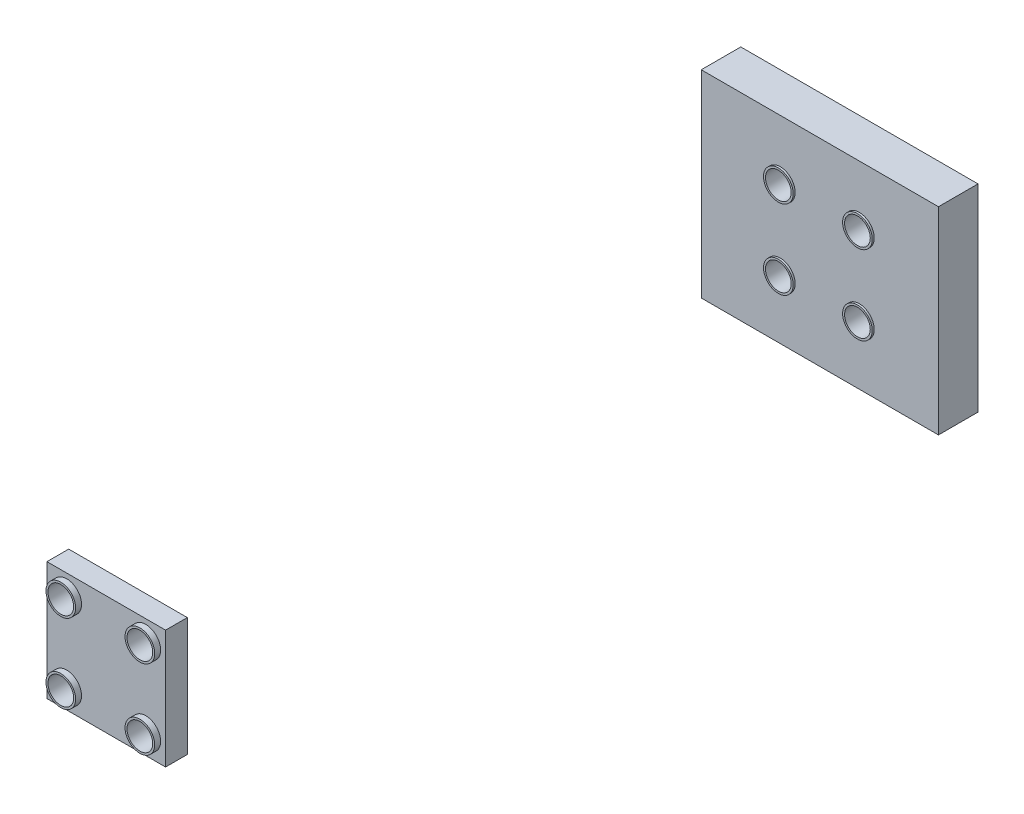
from build123d import *

# Parameters (mm, degrees)
THICKEN1_START       = -1500
THICKEN1_OUTLINE_W   = 3000
THICKEN1_OUTLINE_H   = 50
THICKEN1_DEPTH       = 3000
THICKEN2_START       = -1500
THICKEN2_OUTLINE_W   = 3000
THICKEN2_OUTLINE_H   = 500
THICKEN2_DEPTH       = 50
THICKEN3_START       = 1450
THICKEN3_OUTLINE_W   = 3000
THICKEN3_OUTLINE_H   = 500
THICKEN3_DEPTH       = 50
THICKEN4_START       = -1500
THICKEN4_OUTLINE_W   = 2900
THICKEN4_OUTLINE_H   = 50
THICKEN4_DEPTH       = 3000
THICKEN6_START       = -1500
THICKEN6_OUTLINE_W   = 2900
THICKEN6_OUTLINE_H   = 450
THICKEN6_DEPTH       = 50
THICKEN8_START       = 1450
THICKEN8_OUTLINE_W   = 2900
THICKEN8_OUTLINE_H   = 450
THICKEN8_DEPTH       = 50
SKETCH3_W            = 6000
SKETCH3_H            = 5000
BOSS_EXTRUDE1_DEPTH  = 1000
CUT_EXTRUDE3_START   = -20000
SKETCH2_R            = 325
CUT_EXTRUDE3_DEPTH   = 21000
LPATTERN2_COUNT      = 2
LPATTERN2_PITCH      = 2000
LPATTERN2_COUNT_DIR2 = 2
LPATTERN2_PITCH_DIR2 = 2000
SKETCH18_R           = 375
CUT_EXTRUDE5_DEPTH   = 1000
LPATTERN3_COUNT      = 2
LPATTERN3_PITCH      = 2000
LPATTERN3_COUNT_DIR2 = 2
LPATTERN3_PITCH_DIR2 = 2000
CUT_EXTRUDE6_START   = 1000
SKETCH19_R           = 375
CUT_EXTRUDE6_DEPTH   = 2200
LPATTERN4_COUNT      = 2
LPATTERN4_PITCH      = 2000
LPATTERN4_COUNT_DIR2 = 2
LPATTERN4_PITCH_DIR2 = 2000
BOSS_EXTRUDE2_START  = -1050
SKETCH20_R           = 375
SKETCH20_R_2         = 325
BOSS_EXTRUDE2_DEPTH  = 1100
LPATTERN5_COUNT      = 2
LPATTERN5_PITCH      = 2000
LPATTERN5_COUNT_DIR2 = 2
LPATTERN5_PITCH_DIR2 = 2000
SKETCH21_R           = 375
SKETCH21_R_2         = 325
BOSS_EXTRUDE3_DEPTH  = 800
LPATTERN6_COUNT      = 2
LPATTERN6_PITCH      = 2000
LPATTERN6_COUNT_DIR2 = 2
LPATTERN6_PITCH_DIR2 = 2000


# Read off the part's stored shape, not the designer's step: Thicken1, Thicken2, Thicken3, Thicken4, Thicken6, Thicken8
with BuildPart() as part:
    # Thicken1 outline → Thicken1 (new body)
    with BuildSketch(Plane.YZ.offset(THICKEN1_START)):
        with Locations((0, 25)):
            Rectangle(THICKEN1_OUTLINE_W, THICKEN1_OUTLINE_H)
    extrude(amount=THICKEN1_DEPTH)

    # Thicken2 outline → Thicken2 (add)
    with BuildSketch(Plane.YZ.offset(THICKEN2_START)):
        with Locations((0, -250)):
            Rectangle(THICKEN2_OUTLINE_W, THICKEN2_OUTLINE_H)
    extrude(amount=THICKEN2_DEPTH)

    # Thicken3 outline → Thicken3 (add)
    with BuildSketch(Plane.YZ.offset(THICKEN3_START)):
        with Locations((0, -250)):
            Rectangle(THICKEN3_OUTLINE_W, THICKEN3_OUTLINE_H)
    extrude(amount=THICKEN3_DEPTH)

    # Thicken4 outline → Thicken4 (add)
    with BuildSketch(Plane(origin=(0, 0, 0), x_dir=(1, 0, 0), z_dir=(0, 1, 0)).offset(THICKEN4_START)):
        with Locations((0, 475)):
            Rectangle(THICKEN4_OUTLINE_W, THICKEN4_OUTLINE_H)
    extrude(amount=THICKEN4_DEPTH)

    # Thicken6 outline → Thicken6 (add)
    with BuildSketch(Plane(origin=(0, 0, 0), x_dir=(1, 0, 0), z_dir=(0, 1, 0)).offset(THICKEN6_START)):
        with Locations((0, 225)):
            Rectangle(THICKEN6_OUTLINE_W, THICKEN6_OUTLINE_H)
    extrude(amount=THICKEN6_DEPTH)

    # Thicken8 outline → Thicken8 (add)
    with BuildSketch(Plane(origin=(0, 0, 0), x_dir=(1, 0, 0), z_dir=(0, 1, 0)).offset(THICKEN8_START)):
        with Locations((0, 225)):
            Rectangle(THICKEN8_OUTLINE_W, THICKEN8_OUTLINE_H)
    extrude(amount=THICKEN8_DEPTH)


with BuildPart() as body_2:
    # Sketch3 → Boss-Extrude1 (new body)
    with BuildSketch(Plane.XY.offset(-18000)):
        Rectangle(SKETCH3_W, SKETCH3_H)
    extrude(amount=-BOSS_EXTRUDE1_DEPTH)


with BuildPart() as cut_extrude3_tool:
    # Sketch2 → Cut-Extrude3 (new body)
    with BuildSketch(Plane.XY.offset(CUT_EXTRUDE3_START)):
        with Locations((1000, 1000)):
            Circle(SKETCH2_R)
    cut_extrude3 = extrude(amount=CUT_EXTRUDE3_DEPTH)


with BuildPart() as part_1:
    add(part.part)

    # Cut-Extrude3: cut by cut_extrude3_tool
    add(cut_extrude3_tool.part, mode=Mode.SUBTRACT)


with BuildPart() as body_2_1:
    add(body_2.part)

    # Cut-Extrude3: cut by cut_extrude3_tool
    add(cut_extrude3_tool.part, mode=Mode.SUBTRACT)


with BuildPart() as lpattern2_tool:
    # LPattern2: Cut-Extrude3 2 × 2
    with Locations(*[(-i * LPATTERN2_PITCH, -j * LPATTERN2_PITCH_DIR2, 0) for i in range(LPATTERN2_COUNT) for j in range(LPATTERN2_COUNT_DIR2) if (i, j) != (0, 0)]):
        add(cut_extrude3)


with BuildPart() as part_2:
    add(part_1.part)

    # LPattern2: cut by lpattern2_tool
    add(lpattern2_tool.part, mode=Mode.SUBTRACT)

    # Sketch18 → Cut-Extrude5 (cut)
    with BuildSketch(Plane.XY.offset(200)):
        with Locations((1000, 1000)):
            Circle(SKETCH18_R)
    cut_extrude5 = extrude(amount=-CUT_EXTRUDE5_DEPTH, mode=Mode.SUBTRACT)

    # LPattern3: Cut-Extrude5 2 × 2
    with Locations(*[(-i * LPATTERN3_PITCH, -j * LPATTERN3_PITCH_DIR2, 0) for i in range(LPATTERN3_COUNT) for j in range(LPATTERN3_COUNT_DIR2) if (i, j) != (0, 0)]):
        add(cut_extrude5, mode=Mode.SUBTRACT)


with BuildPart() as body_2_2:
    add(body_2_1.part)

    # LPattern2: cut by lpattern2_tool
    add(lpattern2_tool.part, mode=Mode.SUBTRACT)

    # Sketch19 → Cut-Extrude6 (cut)
    with BuildSketch(Plane.XY.offset(-18000).offset(CUT_EXTRUDE6_START)):
        with Locations((1000, 1000)):
            Circle(SKETCH19_R)
    cut_extrude6 = extrude(amount=-CUT_EXTRUDE6_DEPTH, mode=Mode.SUBTRACT)

    # LPattern4: Cut-Extrude6 2 × 2
    with Locations(*[(-i * LPATTERN4_PITCH, -j * LPATTERN4_PITCH_DIR2, 0) for i in range(LPATTERN4_COUNT) for j in range(LPATTERN4_COUNT_DIR2) if (i, j) != (0, 0)]):
        add(cut_extrude6, mode=Mode.SUBTRACT)


with BuildPart() as body_3:
    # Sketch20 → Boss-Extrude2 (new body)
    with BuildSketch(Plane.XY.offset(-18000).offset(BOSS_EXTRUDE2_START)):
        with Locations((1000, 1000)):
            Circle(SKETCH20_R)
        with Locations((1000, 1000)):
            Circle(SKETCH20_R_2, mode=Mode.SUBTRACT)
    boss_extrude2 = extrude(amount=BOSS_EXTRUDE2_DEPTH)


with BuildPart() as lpattern5_1:
    # LPattern5: Boss-Extrude2 2 × 2
    with Locations(*[(-i * LPATTERN5_PITCH, -j * LPATTERN5_PITCH_DIR2, 0) for i in range(LPATTERN5_COUNT) for j in range(LPATTERN5_COUNT_DIR2) if (i, j) != (0, 0)]):
        add(boss_extrude2)


with BuildPart() as body_7:
    # Sketch21 → Boss-Extrude3 (new body)
    with BuildSketch(Plane.XY.offset(200)):
        with Locations((1000, 1000)):
            Circle(SKETCH21_R)
        with Locations((1000, 1000)):
            Circle(SKETCH21_R_2, mode=Mode.SUBTRACT)
    boss_extrude3 = extrude(amount=-BOSS_EXTRUDE3_DEPTH)


with BuildPart() as lpattern6_1:
    # LPattern6: Boss-Extrude3 2 × 2
    with Locations(*[(-j * LPATTERN6_PITCH_DIR2, -i * LPATTERN6_PITCH, 0) for i in range(LPATTERN6_COUNT) for j in range(LPATTERN6_COUNT_DIR2) if (i, j) != (0, 0)]):
        add(boss_extrude3)


solid = Compound([part_2.part, body_2_2.part, body_3.part, lpattern5_1.part, body_7.part, lpattern6_1.part])
